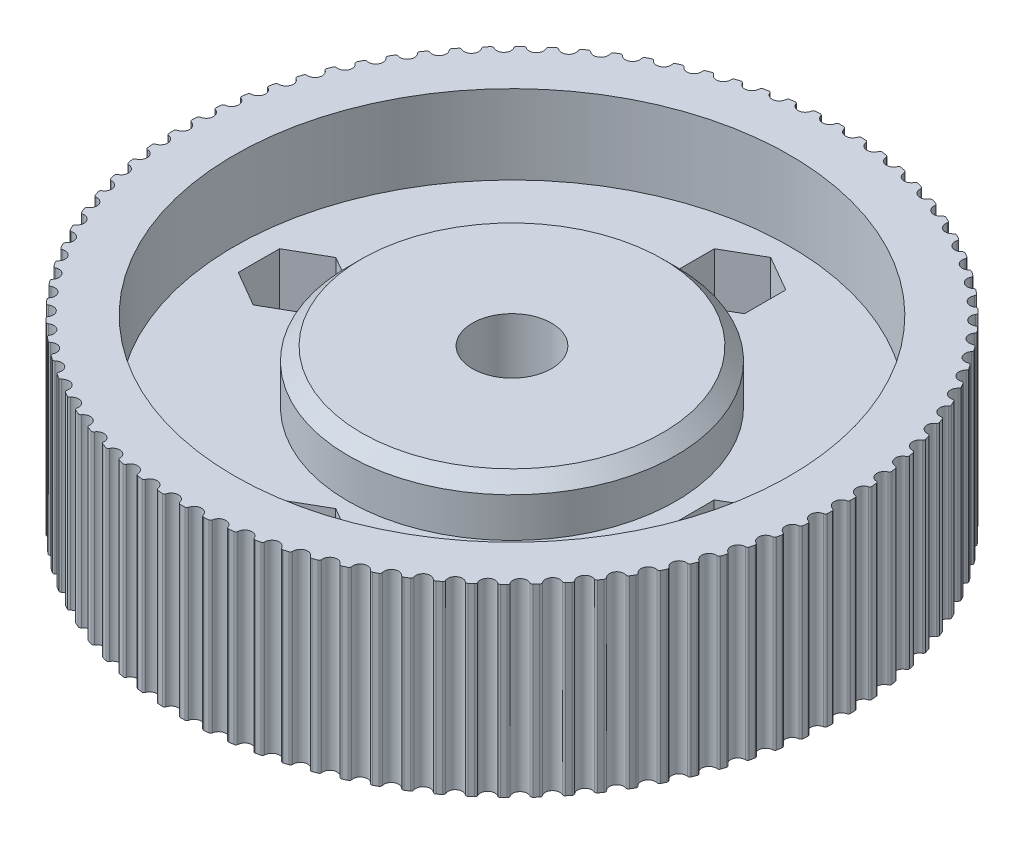
from build123d import *

# Parameters (mm, degrees)
SKETCH1_R                = 25
SKETCH1_R_2              = 6.85
BOSS_EXTRUDE1_DEPTH      = 14
SKETCH2_R                = 21.075
SKETCH2_R_2              = 12.425
CUT_EXTRUDE1_DEPTH       = 6
SKETCH5_R                = 0.55
CUT_EXTRUDE3_DEPTH       = 14
FILLET1_R                = 0.16
CIRPATTERN1_COUNT        = 90
FILLET1_OF_CIRPATTERN1_R = 0.16
CUT_EXTRUDE4_START       = -2
SKETCH9_R                = 12.45
SKETCH9_R_2              = 6.85
CUT_EXTRUDE4_DEPTH       = 2
SKETCH10_R               = 1.5
CUT_EXTRUDE5_DEPTH       = 8
CUT_EXTRUDE6_DEPTH       = 4
BOSS_EXTRUDE2_START      = -5
SKETCH12_R               = 6.85
SKETCH12_R_2             = 3
BOSS_EXTRUDE2_DEPTH      = 5
CHAMFER2_SIZE            = 1


with BuildPart() as part:
    # Sketch1 → Boss-Extrude1 (new body)
    with BuildSketch(Plane(origin=(0, 0, 0), x_dir=(1, 0, 0), z_dir=(0, 1, 0))):
        with Locations(Location((0, 0, 0), (0, 0, 270))):
            Circle(SKETCH1_R)
        with Locations(Location((0, 0, 0), (0, 0, 270))):
            Circle(SKETCH1_R_2, mode=Mode.SUBTRACT)
    extrude(amount=BOSS_EXTRUDE1_DEPTH)

    # Sketch2 → Cut-Extrude1 (cut)
    with BuildSketch(Plane(origin=(0, 14, 0), x_dir=(1, 0, 0), z_dir=(0, 1, 0))):
        with Locations(Location((0, 0, 0), (0, 0, 270))):
            Circle(SKETCH2_R)
        with Locations(Location((0, 0, 0), (0, 0, 270))):
            Circle(SKETCH2_R_2, mode=Mode.SUBTRACT)
    extrude(amount=-CUT_EXTRUDE1_DEPTH, mode=Mode.SUBTRACT)

    # Sketch5 → Cut-Extrude3 (cut)
    with BuildSketch(Plane(origin=(0, 14, 0), x_dir=(1, 0, 0), z_dir=(0, 1, 0))):
        with Locations((25, 0)):
            Circle(SKETCH5_R)
    cut_extrude3 = extrude(amount=-CUT_EXTRUDE3_DEPTH, mode=Mode.SUBTRACT)

    # Fillet1
    fillet1_edges = [part.edges().sort_by_distance(p)[0] for p in [
        (24.99395, 7, -0.549966724),
        (24.99395, 7, 0.549966724),
    ]]
    fillet(fillet1_edges, radius=FILLET1_R)

    # CirPattern1: Cut-Extrude3 ×90 about axis
    cirpattern1_axis = Axis((0, 0, 0), (0, 1, 0))
    for i in range(1, CIRPATTERN1_COUNT):
        add(cut_extrude3.rotate(cirpattern1_axis, i * 360 / CIRPATTERN1_COUNT), mode=Mode.SUBTRACT)

    # Fillet1 of CirPattern1
    fillet1_of_cirpattern1_edges = [part.edges().sort_by_distance(p)[0] for p in [
        (24.894702255, 7, -2.29211685),
        (24.971429733, 7, -1.194862784),
        (24.674170022, 7, -4.023100012),
        (24.827251171, 7, -2.933871041),
        (24.333427714, 7, -5.734483036),
        (24.562116737, 7, -4.658585773),
        (23.874135392, 7, -7.417928235),
        (24.177318139, 7, -6.360604344),
        (23.298530682, 7, -9.065234033),
        (23.674730077, 7, -8.031634689),
        (22.609417872, 7, -10.668374923),
        (23.05680111, 7, -9.663535718),
        (21.810154251, 7, -12.219540562),
        (22.326541726, 7, -11.248356972),
        (20.904633751, 7, -13.711173828),
        (21.487509675, 7, -12.778377361),
        (19.897267977, 7, -15.136007633),
        (20.543792636, 7, -14.24614278),
        (18.792964713, 7, -16.48710033),
        (19.499988305, 7, -15.644502424),
        (17.597104014, 7, -17.757869532),
        (18.361181991, 7, -16.966643625),
        (16.315511994, 7, -18.942124178),
        (17.132921844, 7, -18.206125043),
        (14.954432439, 7, -20.0340947),
        (15.821191824, 7, -19.35690805),
        (13.520496392, 7, -21.028461126),
        (14.432382548, 7, -20.413386147),
        (12.020689846, 7, -21.920379003),
        (12.973260154, 7, -21.370412279),
        (10.462319707, 7, -22.705502997),
        (11.450933341, 7, -22.22332391),
        (8.852978198, 7, -23.380008063),
        (9.872818733, 7, -22.967965741),
        (7.20050587, 7, -23.94060808),
        (8.246604743, 7, -23.600709951),
        (5.512953401, 7, -24.38457186),
        (6.580214124, 7, -24.118473875),
        (3.798542377, 7, -24.709736458),
        (4.881765364, 7, -24.518735019),
        (2.065625236, 7, -24.914517703),
        (3.159533133, 7, -24.79954335),
        (0.322644576, 7, -24.997917923),
        (1.421907975, 7, -24.959530799),
        (-1.421907975, 7, -24.959530799),
        (-0.322644576, 7, -24.997917923),
        (-3.159533133, 7, -24.79954335),
        (-2.065625236, 7, -24.914517703),
        (-4.881765364, 7, -24.518735019),
        (-3.798542377, 7, -24.709736458),
        (-6.580214124, 7, -24.118473875),
        (-5.512953401, 7, -24.38457186),
        (-8.246604743, 7, -23.600709951),
        (-7.20050587, 7, -23.94060808),
        (-9.872818733, 7, -22.967965741),
        (-8.852978198, 7, -23.380008063),
        (-11.450933341, 7, -22.22332391),
        (-10.462319707, 7, -22.705502997),
        (-12.973260154, 7, -21.370412279),
        (-12.020689846, 7, -21.920379003),
        (-14.432382548, 7, -20.413386147),
        (-13.520496392, 7, -21.028461126),
        (-15.821191824, 7, -19.35690805),
        (-14.954432439, 7, -20.0340947),
        (-17.132921844, 7, -18.206125043),
        (-16.315511994, 7, -18.942124178),
        (-18.361181991, 7, -16.966643625),
        (-17.597104014, 7, -17.757869532),
        (-19.499988305, 7, -15.644502424),
        (-18.792964713, 7, -16.48710033),
        (-20.543792636, 7, -14.24614278),
        (-19.897267977, 7, -15.136007633),
        (-21.487509675, 7, -12.778377361),
        (-20.904633751, 7, -13.711173828),
        (-22.326541726, 7, -11.248356972),
        (-21.810154251, 7, -12.219540562),
        (-23.05680111, 7, -9.663535718),
        (-22.609417872, 7, -10.668374923),
        (-23.674730077, 7, -8.031634689),
        (-23.298530682, 7, -9.065234033),
        (-24.177318139, 7, -6.360604344),
        (-23.874135392, 7, -7.417928235),
        (-24.562116737, 7, -4.658585773),
        (-24.333427714, 7, -5.734483036),
        (-24.827251171, 7, -2.933871041),
        (-24.674170022, 7, -4.023100012),
        (-24.971429733, 7, -1.194862784),
        (-24.894702255, 7, -2.29211685),
        (-24.99395, 7, 0.549966724),
        (-24.99395, 7, -0.549966724),
        (-24.894702255, 7, 2.29211685),
        (-24.971429733, 7, 1.194862784),
        (-24.674170022, 7, 4.023100012),
        (-24.827251171, 7, 2.933871041),
        (-24.333427714, 7, 5.734483036),
        (-24.562116737, 7, 4.658585773),
        (-23.874135392, 7, 7.417928235),
        (-24.177318139, 7, 6.360604344),
        (-23.298530682, 7, 9.065234033),
        (-23.674730077, 7, 8.031634689),
        (-22.609417872, 7, 10.668374923),
        (-23.05680111, 7, 9.663535718),
        (-21.810154251, 7, 12.219540562),
        (-22.326541726, 7, 11.248356972),
        (-20.904633751, 7, 13.711173828),
        (-21.487509675, 7, 12.778377361),
        (-19.897267977, 7, 15.136007633),
        (-20.543792636, 7, 14.24614278),
        (-18.792964713, 7, 16.48710033),
        (-19.499988305, 7, 15.644502424),
        (-17.597104014, 7, 17.757869532),
        (-18.361181991, 7, 16.966643625),
        (-16.315511994, 7, 18.942124178),
        (-17.132921844, 7, 18.206125043),
        (-14.954432439, 7, 20.0340947),
        (-15.821191824, 7, 19.35690805),
        (-13.520496392, 7, 21.028461126),
        (-14.432382548, 7, 20.413386147),
        (-12.020689846, 7, 21.920379003),
        (-12.973260154, 7, 21.370412279),
        (-10.462319707, 7, 22.705502997),
        (-11.450933341, 7, 22.22332391),
        (-8.852978198, 7, 23.380008063),
        (-9.872818733, 7, 22.967965741),
        (-7.20050587, 7, 23.94060808),
        (-8.246604743, 7, 23.600709951),
        (-5.512953401, 7, 24.38457186),
        (-6.580214124, 7, 24.118473875),
        (-3.798542377, 7, 24.709736458),
        (-4.881765364, 7, 24.518735019),
        (-2.065625236, 7, 24.914517703),
        (-3.159533133, 7, 24.79954335),
        (-0.322644576, 7, 24.997917923),
        (-1.421907975, 7, 24.959530799),
        (1.421907975, 7, 24.959530799),
        (0.322644576, 7, 24.997917923),
        (3.159533133, 7, 24.79954335),
        (2.065625236, 7, 24.914517703),
        (4.881765364, 7, 24.518735019),
        (3.798542377, 7, 24.709736458),
        (6.580214124, 7, 24.118473875),
        (5.512953401, 7, 24.38457186),
        (8.246604743, 7, 23.600709951),
        (7.20050587, 7, 23.94060808),
        (9.872818733, 7, 22.967965741),
        (8.852978198, 7, 23.380008063),
        (11.450933341, 7, 22.22332391),
        (10.462319707, 7, 22.705502997),
        (12.973260154, 7, 21.370412279),
        (12.020689846, 7, 21.920379003),
        (14.432382548, 7, 20.413386147),
        (13.520496392, 7, 21.028461126),
        (15.821191824, 7, 19.35690805),
        (14.954432439, 7, 20.0340947),
        (17.132921844, 7, 18.206125043),
        (16.315511994, 7, 18.942124178),
        (18.361181991, 7, 16.966643625),
        (17.597104014, 7, 17.757869532),
        (19.499988305, 7, 15.644502424),
        (18.792964713, 7, 16.48710033),
        (20.543792636, 7, 14.24614278),
        (19.897267977, 7, 15.136007633),
        (21.487509675, 7, 12.778377361),
        (20.904633751, 7, 13.711173828),
        (22.326541726, 7, 11.248356972),
        (21.810154251, 7, 12.219540562),
        (23.05680111, 7, 9.663535718),
        (22.609417872, 7, 10.668374923),
        (23.674730077, 7, 8.031634689),
        (23.298530682, 7, 9.065234033),
        (24.177318139, 7, 6.360604344),
        (23.874135392, 7, 7.417928235),
        (24.562116737, 7, 4.658585773),
        (24.333427714, 7, 5.734483036),
        (24.827251171, 7, 2.933871041),
        (24.674170022, 7, 4.023100012),
        (24.971429733, 7, 1.194862784),
        (24.894702255, 7, 2.29211685),
    ]]
    fillet(fillet1_of_cirpattern1_edges, radius=FILLET1_OF_CIRPATTERN1_R)

    # Sketch9 → Cut-Extrude4 (cut)
    with BuildSketch(Plane(origin=(0, 14, 0), x_dir=(1, 0, 0), z_dir=(0, 1, 0)).offset(CUT_EXTRUDE4_START)):
        Circle(SKETCH9_R)
        with Locations(Location((0, 0, 0), (0, 0, 270))):
            Circle(SKETCH9_R_2, mode=Mode.SUBTRACT)
    extrude(amount=CUT_EXTRUDE4_DEPTH, mode=Mode.SUBTRACT)

    # Sketch10 → Cut-Extrude5 (cut)
    with BuildSketch(Plane(origin=(0, 8, 0), x_dir=(1, 0, 0), z_dir=(0, 1, 0))):
        with Locations(Location((16.5, 0, 0), (0, 0, 270))):
            Circle(SKETCH10_R)
        with Locations(Location((0, -16.5, 0), (0, 0, 270))):
            Circle(SKETCH10_R)
        with Locations(Location((-16.5, 0, 0), (0, 0, 270))):
            Circle(SKETCH10_R)
        with Locations(Location((0, 16.5, 0), (0, 0, 270))):
            Circle(SKETCH10_R)
    extrude(amount=-CUT_EXTRUDE5_DEPTH, mode=Mode.SUBTRACT)

    # Sketch11 → Cut-Extrude6 (cut)
    with BuildSketch(Plane(origin=(0, 8, 0), x_dir=(1, 0, 0), z_dir=(0, 1, 0))):
        Polygon((16.510984631, -3.124980694), (19.211804983, -1.552977378), (19.200820352, 1.572003316), (16.489015369, 3.124980694), (13.788195017, 1.552977378), (13.799179648, -1.572003316), align=None)
        Polygon((-13.799179648, -1.572003316), (-16.510984631, -3.124980694), (-19.211804983, -1.552977378), (-19.200820352, 1.572003316), (-16.489015369, 3.124980694), (-13.788195017, 1.552977378), align=None)
        Polygon((0, 13.375), (2.706329387, 14.9375), (2.706329387, 18.0625), (0, 19.625), (-2.706329387, 18.0625), (-2.706329387, 14.9375), align=None)
        Polygon((-2.706329387, -14.9375), (0, -13.375), (2.706329387, -14.9375), (2.706329387, -18.0625), (0, -19.625), (-2.706329387, -18.0625), align=None)
    extrude(amount=-CUT_EXTRUDE6_DEPTH, mode=Mode.SUBTRACT)

    # Sketch12 → Boss-Extrude2 (add)
    with BuildSketch(Plane(origin=(0, 12, 0), x_dir=(1, 0, 0), z_dir=(0, 1, 0)).offset(BOSS_EXTRUDE2_START)):
        with Locations(Location((0, 0, 0), (0, 0, 270))):
            Circle(SKETCH12_R)
        with Locations(Location((0, 0, 0), (0, 0, 270))):
            Circle(SKETCH12_R_2, mode=Mode.SUBTRACT)
    extrude(amount=BOSS_EXTRUDE2_DEPTH)

    # Chamfer2
    chamfer2_edges = [part.edges().sort_by_distance(p)[0] for p in [
        (0, 12, -12.425),
    ]]
    chamfer(chamfer2_edges, length=CHAMFER2_SIZE)


solid = part.part
